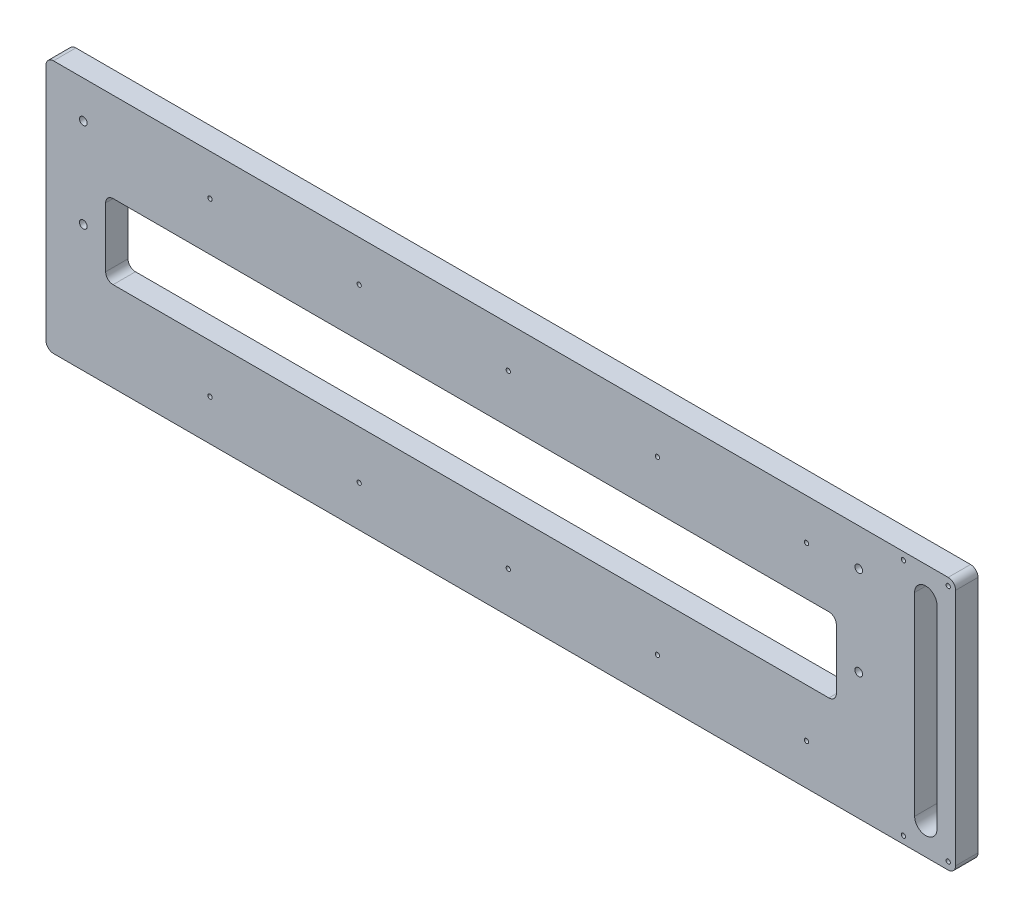
from build123d import *

# Parameters (mm, degrees)
SKETCH2_W                   = 723.9
SKETCH2_H                   = 215.9
BOSS_EXTRUDE1_DEPTH         = 19.05
CUT_EXTRUDE3_DEPTH          = 409.675659906
F_27_0_144_DIAMETER_HOLE1_D = 3.6576
F_1_4_CLEARANCE_HOLE1_D     = 6.5278
SKETCH22_W                  = 19.05
SKETCH22_H                  = 215.9
BOSS_EXTRUDE2_DEPTH         = 50.8
FILLET1_R                   = 6.35
F_6_CLEARANCE_HOLE1_D       = 3.6576
CUT_EXTRUDE4_DEPTH          = 76.2


with BuildPart() as part:
    # Sketch2 → Boss-Extrude1 (new body)
    with BuildSketch(Plane.XY):
        with Locations((-31.75, 0)):
            Rectangle(SKETCH2_W, SKETCH2_H)
    extrude(amount=BOSS_EXTRUDE1_DEPTH)

    # Sketch13 → Cut-Extrude3 (cut, through all)
    with BuildSketch(Plane.XY.offset(19.05)):
        with BuildLine():
            Line((-336.55, -31.75), (273.05, -31.75))
            ThreePointArc((273.05, -31.75), (277.540128061, -29.890128061), (279.4, -25.4))
            Line((279.4, -25.4), (279.4, 25.4))
            ThreePointArc((279.4, 25.4), (277.540128061, 29.890128061), (273.05, 31.75))
            Line((273.05, 31.75), (-336.55, 31.75))
            ThreePointArc((-336.55, 31.75), (-341.040128061, 29.890128061), (-342.9, 25.4))
            Line((-342.9, 25.4), (-342.9, -25.4))
            ThreePointArc((-342.9, -25.4), (-341.040128061, -29.890128061), (-336.55, -31.75))
        make_face()
    extrude(amount=-CUT_EXTRUDE3_DEPTH, mode=Mode.SUBTRACT)

    # #27 (0.144) Diameter Hole1 (through all)
    with Locations(Plane(origin=(0, 0, 0), x_dir=(-1, 0, 0), z_dir=(0, 0, -1))):
        with Locations((0, 0), (-254, 73.025), (-127, 73.025), (0, 73.025), (127, 73.025), (254, 73.025), (-127, -73.025), (0, -73.025), (127, -73.025), (254, -73.025), (-254, -73.025)):
            Hole(F_27_0_144_DIAMETER_HOLE1_D / 2)

    # 1/4 Clearance Hole1 (through all)
    with Locations(Plane(origin=(0, 0, 0), x_dir=(-1, 0, 0), z_dir=(0, 0, -1))):
        with Locations((-298.45, 76.2), (361.95, 76.2), (361.95, 0), (-298.45, 0)):
            Hole(F_1_4_CLEARANCE_HOLE1_D / 2)

    # Sketch22 → Boss-Extrude2 (add)
    with BuildSketch(Plane(origin=(330.2, 0, 0), x_dir=(0, 0, -1), z_dir=(1, 0, 0))):
        with Locations((-9.525, 0)):
            Rectangle(SKETCH22_W, SKETCH22_H)
    extrude(amount=BOSS_EXTRUDE2_DEPTH)

    # Fillet1
    fillet1_edges = [part.edges().sort_by_distance(p)[0] for p in [
        (381, 107.95, 9.525),
        (381, -107.95, 9.525),
        (-393.7, -107.95, 9.525),
        (-393.7, 107.95, 9.525),
    ]]
    fillet(fillet1_edges, radius=FILLET1_R)

    # #6 Clearance Hole1 (through all)
    with Locations(Plane.XY.offset(19.05)):
        with Locations((336.55, -101.6), (355.6, 0), (336.55, 101.6), (374.65, -101.6), (374.65, 101.6)):
            Hole(F_6_CLEARANCE_HOLE1_D / 2)

    # Sketch25 → Cut-Extrude4 (cut)
    with BuildSketch(Plane.XY.offset(19.05)):
        with BuildLine():
            Line((346.075, -82.55), (346.075, 82.55))
            ThreePointArc((346.075, 82.55), (355.6, 92.075), (365.125, 82.55))
            Line((365.125, 82.55), (365.125, -82.55))
            ThreePointArc((365.125, -82.55), (355.6, -92.075), (346.075, -82.55))
        make_face()
    extrude(amount=-CUT_EXTRUDE4_DEPTH, mode=Mode.SUBTRACT)


solid = part.part
